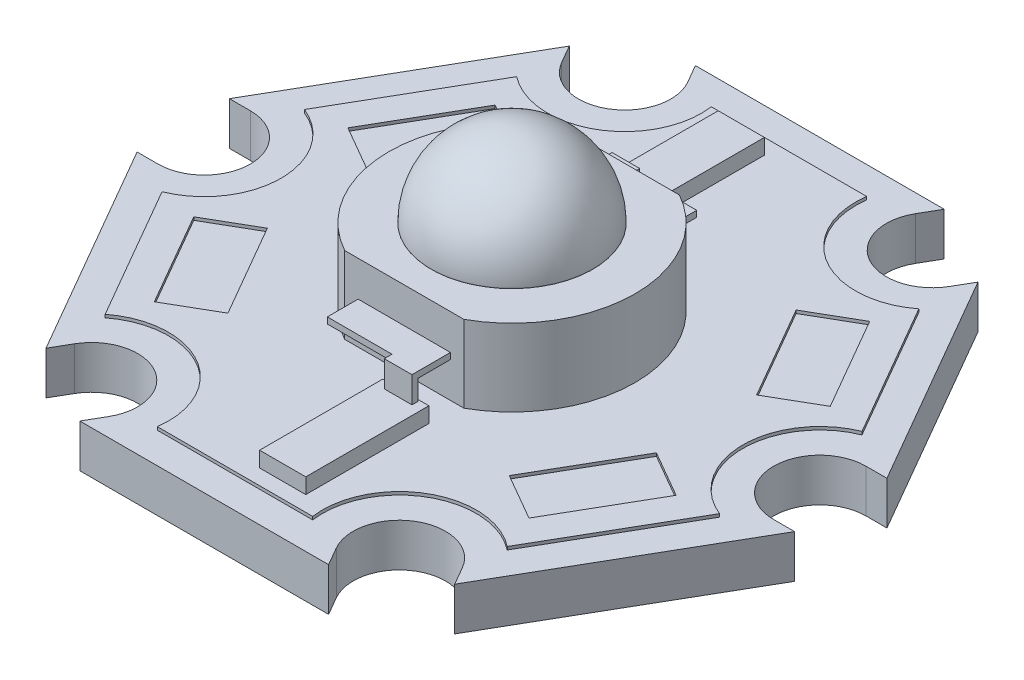
from build123d import *

# Parameters (mm, degrees)
BOSS_EXTRUDE1_DEPTH = 1.5
BOSS_EXTRUDE2_DEPTH = 2.5
SKETCH3_R           = 2.625
BOSS_EXTRUDE3_DEPTH = 0.01
SKETCH4_W           = 3
SKETCH4_H           = 0.2
BOSS_EXTRUDE4_DEPTH = 1
SKETCH5_W           = 0.9
SKETCH5_H           = 0.2
BOSS_EXTRUDE5_DEPTH = 0.25
BOSS_EXTRUDE6_REACH = 17.786
SKETCH6_W           = 0.9
SKETCH6_H           = 0.2
SKETCH8_W           = 1.5
SKETCH8_H           = 4
BOSS_EXTRUDE7_DEPTH = 0.5
CIRPATTERN1_COUNT   = 2
CUT_EXTRUDE1_DEPTH  = 17.115258556
CIRPATTERN2_COUNT   = 6
CUT_EXTRUDE2_DEPTH  = 0.1


# Read off the part's stored shape, not the designer's step: Dome1
with BuildPart() as part:
    # Sketch1 → Boss-Extrude1 (new body)
    with BuildSketch(Plane(origin=(0, 0, 0), x_dir=(1, 0, 0), z_dir=(0, 1, 0))):
        Polygon((-11.547005384, 0), (-5.773502692, -10), (5.773502692, -10), (11.547005384, 0), (5.773502692, 10), (-5.773502692, 10), align=None)
    extrude(amount=BOSS_EXTRUDE1_DEPTH)

    # Sketch2 → Boss-Extrude2 (add)
    with BuildSketch(Plane(origin=(0, 1.5, 0), x_dir=(1, 0, 0), z_dir=(0, 1, 0))):
        with BuildLine():
            Line((-1.936491673, 3.5), (1.936491673, 3.5))
            ThreePointArc((1.936491673, 3.5), (4, 0), (1.936491673, -3.5))
            Line((1.936491673, -3.5), (-1.936491673, -3.5))
            ThreePointArc((-1.936491673, -3.5), (-4, 0), (-1.936491673, 3.5))
        make_face()
    extrude(amount=BOSS_EXTRUDE2_DEPTH)

    # Sketch3 → Boss-Extrude3 (add)
    with BuildSketch(Plane(origin=(0, 4, 0), x_dir=(1, 0, 0), z_dir=(0, 1, 0))):
        with Locations(Location((0, 0, 0), (0, 0, 90))):
            Circle(SKETCH3_R)
    extrude(amount=BOSS_EXTRUDE3_DEPTH)

    # Dome1 outline → Dome1 (revolve)
    with BuildSketch(Plane.XY):
        with BuildLine():
            Line((0, 4.01), (2.625, 4.009999997))
            ThreePointArc((2.625, 4.009999997), (1.856155302, 5.8661553), (0, 6.635))
            Line((0, 6.635), (0, 4.01))
        make_face()
    revolve(axis=Axis((0, 0, 0), (0, 1, 0)))

    # Sketch4 → Boss-Extrude4 (add)
    with BuildSketch(Plane.XY.offset(3.5)):
        with Locations((0, 2.75)):
            Rectangle(SKETCH4_W, SKETCH4_H)
    boss_extrude4 = extrude(amount=BOSS_EXTRUDE4_DEPTH)

    # Sketch5 → Boss-Extrude5 (add)
    with BuildSketch(Plane.XY.offset(4.5)):
        with Locations((1.05, 2.75)):
            Rectangle(SKETCH5_W, SKETCH5_H)
    boss_extrude5 = extrude(amount=BOSS_EXTRUDE5_DEPTH)

    # Sketch6 → Boss-Extrude6 (add, up to next)
    with BuildSketch(Plane.XZ.offset(-2.65), mode=Mode.PRIVATE) as boss_extrude6_sk1:
        with Locations((1.05, 4.65)):
            Rectangle(SKETCH6_W, SKETCH6_H)
    boss_extrude6_tool1 = extrude(boss_extrude6_sk1.sketch, amount=BOSS_EXTRUDE6_REACH, mode=Mode.PRIVATE) - part.part
    boss_extrude6 = boss_extrude6_tool1.solids().sort_by_distance((1.05, 2.65, 4.65))[0]
    add(boss_extrude6)

    # Sketch8 → Boss-Extrude7 (add)
    with BuildSketch(Plane(origin=(0, 1.5, 0), x_dir=(1, 0, 0), z_dir=(0, 1, 0))):
        with Locations((1.05, -6.5)):
            Rectangle(SKETCH8_W, SKETCH8_H)
    boss_extrude7 = extrude(amount=BOSS_EXTRUDE7_DEPTH)

    # CirPattern1: Boss-Extrude4, Boss-Extrude5, Boss-Extrude6, Boss-Extrude7 ×2 about axis
    cirpattern1_axis = Axis((0, 0, 0), (0, 1, 0))
    add([boss_extrude4.rotate(cirpattern1_axis, i * 360 / CIRPATTERN1_COUNT) for i in range(1, CIRPATTERN1_COUNT)])
    add([boss_extrude5.rotate(cirpattern1_axis, i * 360 / CIRPATTERN1_COUNT) for i in range(1, CIRPATTERN1_COUNT)])
    add([boss_extrude6.rotate(cirpattern1_axis, i * 360 / CIRPATTERN1_COUNT) for i in range(1, CIRPATTERN1_COUNT)])
    add([boss_extrude7.rotate(cirpattern1_axis, i * 360 / CIRPATTERN1_COUNT) for i in range(1, CIRPATTERN1_COUNT)])

    # Sketch9 → Cut-Extrude1 (cut, through all)
    with BuildSketch(Plane(origin=(0, 1.5, 0), x_dir=(1, 0, 0), z_dir=(0, 1, 0))):
        with BuildLine():
            Line((-6.200961894, 13.740381057), (-3.700961894, 9.410254038))
            ThreePointArc((-3.700961894, 9.410254038), (-4.25, 7.361215932), (-6.299038106, 7.910254038))
            Line((-6.299038106, 7.910254038), (-8.799038106, 12.240381057))
            ThreePointArc((-8.799038106, 12.240381057), (-8.25, 14.289419162), (-6.200961894, 13.740381057))
        make_face()
    cut_extrude1 = extrude(amount=-CUT_EXTRUDE1_DEPTH, mode=Mode.SUBTRACT)

    # CirPattern2: Cut-Extrude1 ×6 about axis
    cirpattern2_axis = Axis((0, 0, 0), (0, 1, 0))
    for i in range(1, CIRPATTERN2_COUNT):
        add(cut_extrude1.rotate(cirpattern2_axis, i * 360 / CIRPATTERN2_COUNT), mode=Mode.SUBTRACT)

    # Sketch10 → Cut-Extrude2 (cut)
    # profile 1 of 5: a face of its own
    with BuildSketch(Plane(origin=(0, 1.5, 0), x_dir=(1, 0, 0), z_dir=(0, 1, 0))):
        with BuildLine():
            Line((-6.639528096, 8.5), (-10.68097998, 1.5))
            Line((-10.68097998, 1.5), (-10, 1.5))
            ThreePointArc((-10, 1.5), (-8.5, 0), (-10, -1.5))
            Line((-10, -1.5), (-10.68097998, -1.5))
            Line((-10.68097998, -1.5), (-6.639528096, -8.5))
            Line((-6.639528096, -8.5), (-6.299038106, -7.910254038))
            ThreePointArc((-6.299038106, -7.910254038), (-4.25, -7.361215932), (-3.700961894, -9.410254038))
            Line((-3.700961894, -9.410254038), (-4.041451884, -10))
            Line((-4.041451884, -10), (4.041451884, -10))
            Line((4.041451884, -10), (3.700961894, -9.410254038))
            ThreePointArc((3.700961894, -9.410254038), (4.25, -7.361215932), (6.299038106, -7.910254038))
            Line((6.299038106, -7.910254038), (6.639528096, -8.5))
            Line((6.639528096, -8.5), (10.68097998, -1.5))
            Line((10.68097998, -1.5), (10, -1.5))
            ThreePointArc((10, -1.5), (8.5, 0), (10, 1.5))
            Line((10, 1.5), (10.68097998, 1.5))
            Line((10.68097998, 1.5), (6.639528096, 8.5))
            Line((6.639528096, 8.5), (6.299038106, 7.910254038))
            ThreePointArc((6.299038106, 7.910254038), (4.25, 7.361215932), (3.700961894, 9.410254038))
            Line((3.700961894, 9.410254038), (4.041451884, 10))
            Line((4.041451884, 10), (-4.041451884, 10))
            Line((-4.041451884, 10), (-3.700961894, 9.410254038))
            ThreePointArc((-3.700961894, 9.410254038), (-4.25, 7.361215932), (-6.299038106, 7.910254038))
            Line((-6.299038106, 7.910254038), (-6.639528096, 8.5))
        make_face()
        with BuildLine():
            ThreePointArc((-2.523193047, 9), (-3.75, 6.495190528), (-6.53263211, 6.685149278))
            Line((-6.53263211, 6.685149278), (-9.055825158, 2.314850722))
            ThreePointArc((-9.055825158, 2.314850722), (-7.5, 0), (-9.055825158, -2.314850722))
            Line((-9.055825158, -2.314850722), (-6.53263211, -6.685149278))
            ThreePointArc((-6.53263211, -6.685149278), (-3.75, -6.495190528), (-2.523193047, -9))
            Line((-2.523193047, -9), (2.523193047, -9))
            ThreePointArc((2.523193047, -9), (3.75, -6.495190528), (6.53263211, -6.685149278))
            Line((6.53263211, -6.685149278), (9.055825158, -2.314850722))
            ThreePointArc((9.055825158, -2.314850722), (7.5, 0), (9.055825158, 2.314850722))
            Line((9.055825158, 2.314850722), (6.53263211, 6.685149278))
            ThreePointArc((6.53263211, 6.685149278), (3.75, 6.495190528), (2.523193047, 9))
            Line((2.523193047, 9), (-2.523193047, 9))
        make_face(mode=Mode.SUBTRACT)
    # profile 2 of 5: a face of its own
    with BuildSketch(Plane(origin=(0, 1.5, 0), x_dir=(1, 0, 0), z_dir=(0, 1, 0))):
        Polygon((-7.835723618, 2.503231198), (-6.320179161, 1.628231198), (-4.570179161, 4.659320111), (-6.085723618, 5.534320111), align=None)
    # profile 3 of 5: a face of its own
    with BuildSketch(Plane(origin=(0, 1.5, 0), x_dir=(1, 0, 0), z_dir=(0, 1, 0))):
        Polygon((-6.320179161, -1.628231198), (-4.570179161, -4.659320111), (-6.085723618, -5.534320111), (-7.835723618, -2.503231198), align=None)
    # profile 4 of 5: a face of its own
    with BuildSketch(Plane(origin=(0, 1.5, 0), x_dir=(1, 0, 0), z_dir=(0, 1, 0))):
        Polygon((7.835723618, -2.503231198), (6.085723618, -5.534320111), (4.570179161, -4.659320111), (6.320179161, -1.628231198), align=None)
    # profile 5 of 5: a face of its own
    with BuildSketch(Plane(origin=(0, 1.5, 0), x_dir=(1, 0, 0), z_dir=(0, 1, 0))):
        Polygon((7.835723618, 2.503231198), (6.320179161, 1.628231198), (4.570179161, 4.659320111), (6.085723618, 5.534320111), align=None)
    extrude(amount=-CUT_EXTRUDE2_DEPTH, mode=Mode.SUBTRACT)


solid = part.part
